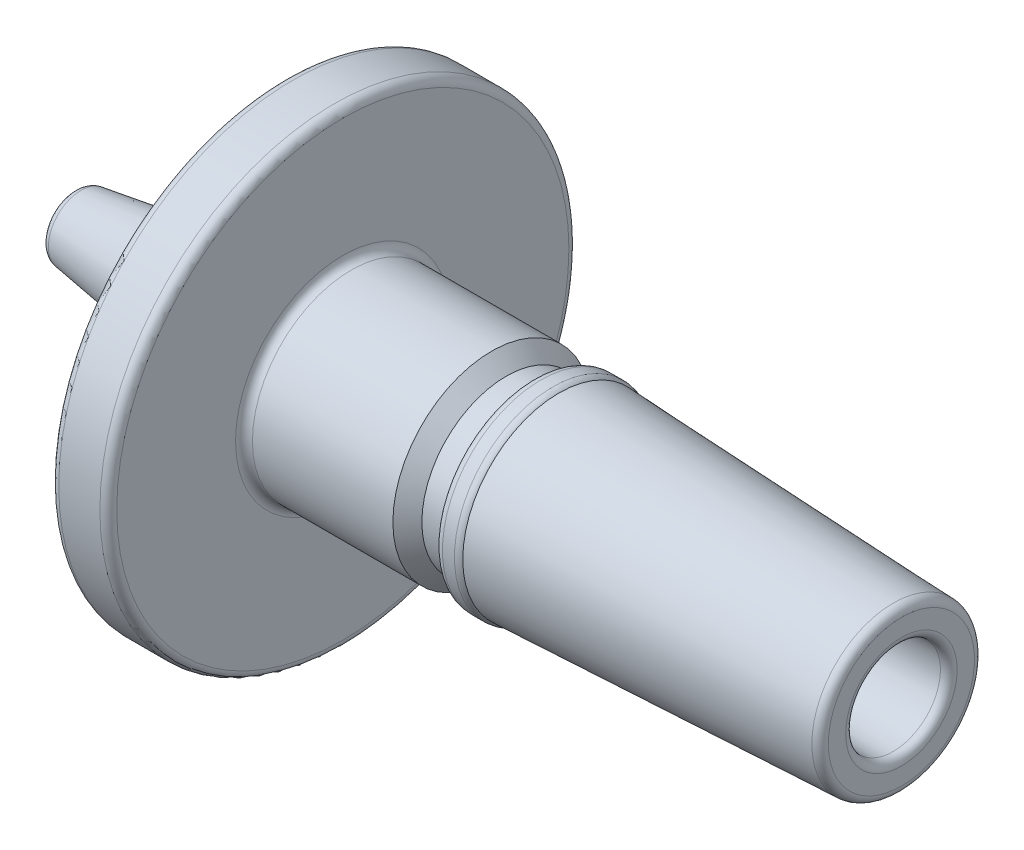
from build123d import *

# Parameters (mm, degrees)
FILLET1_R = 0.2032


with BuildPart() as part:
    # Sketch1 → Revolve1 (revolve)
    with BuildSketch(Plane(origin=(0, 0, 0), x_dir=(1, 0, 0), z_dir=(0, 1, 0)), mode=Mode.PRIVATE) as revolve1_sk:
        Polygon((1.3970000000000002, 0.9080199159363341), (14.858999999999998, 1.143), (14.858999999999998, 1.9557999999999998), (6.603999999999999, 2.3162210837097064), (6.603999999999999, 2.3749000000000002), (5.9689999999999985, 2.3749000000000002), (5.9689999999999985, 2.032), (5.333999999999999, 2.0319999999999996), (4.98475, 2.38125), (1.3970000000000005, 2.381249999999999), (1.3970000000000005, 5.6515), (0, 5.6515), (5.5e-16, 1.143), (-1.2699999999999994, 0.9525000000000002), (-2.5400000000000005, 0.9525000000000001), (-2.5400000000000005, 1.143), (-5.079999999999999, 0.762), (-5.079999999999999, 0.635), (1.397000000000001, 0.635), align=None)
    revolve(revolve1_sk.sketch.rotate(Axis((0, 0, 0), (1, 0, 0)), 180), axis=Axis((0, 0, 0), (1, 0, 0)))

    # Fillet1
    # the kernel refuses this fillet: 0.2032 mm, written as the material it adds along each edge
    with BuildSketch(Plane(origin=(-1.2699999999999994, 0, 0), x_dir=(0, 1.2e-16, 1), z_dir=(0, 1, -1.2e-16))) as fillet1_piece_1:
        with BuildLine():
            CenterArc((0.9525000000000002 + FILLET1_R, -FILLET1_R * 0.0745828053856), FILLET1_R, 171.46923439005187, 8.530765609948162)
            Line((0.9525000000000001, -FILLET1_R * 0.0745828053856), (0.9525000000000002, 0))
            Line((0.9525000000000002, 0), (0.9525000000000002 + FILLET1_R * 0.0110636471317, FILLET1_R * 0.0737576475447))
        make_face()
    revolve(axis=Axis((-1.2699999999999994, 0, 0), (1, 0, 0)))
    with BuildSketch(Plane(origin=(5.5e-16, 0, 0), x_dir=(0, 1.2e-16, 1), z_dir=(0, 1, -1.2e-16))) as fillet1_piece_2:
        with BuildLine():
            CenterArc((1.143 + FILLET1_R * 0.861187420808, -FILLET1_R), FILLET1_R, 90, 81.46923439005175)
            Line((1.143 - FILLET1_R * 0.12774893206, -FILLET1_R * 0.85165954707), (1.143, 0))
            Line((1.143, 0), (1.143 + FILLET1_R * 0.861187420808, -5.5e-16))
        make_face()
    revolve(axis=Axis((5.5e-16, 0, 0), (1, 0, 0)))
    with BuildSketch(Plane(origin=(1.3970000000000005, 0, 0), x_dir=(0, 1.2e-16, 1), z_dir=(0, 1, -1.2e-16))) as fillet1_piece_3:
        with BuildLine():
            CenterArc((2.381249999999999 + FILLET1_R, FILLET1_R), FILLET1_R, 180, 89.99999999999977)
            Line((2.381249999999999 + FILLET1_R, 0), (2.381249999999999, 0))
            Line((2.381249999999999, 0), (2.38125, FILLET1_R))
        make_face()
    revolve(axis=Axis((1.3970000000000005, 0, 0), (1, 0, 0)))
    # the kernel refuses this fillet: 0.2032 mm, written as the material it takes off along each edge
    with BuildSketch(Plane(origin=(-5.079999999999999, 0, 0), x_dir=(0, 1.2e-16, 1), z_dir=(0, 1, -1.2e-16))) as fillet1_2_piece_1:
        with BuildLine():
            CenterArc((0.5861113953629584, 0.19723119514073506), FILLET1_R, 283.92157342879153, 67.54766096126022)
            Line((0.7870632622657965, 0.16708841510530892), (0.762, 0))
            Line((0.762, 0), (0.6350000000000002, -8.9e-16))
        make_face()
    revolve(axis=Axis((-5.079999999999999, 0, 0), (1, 0, 0)), mode=Mode.SUBTRACT)
    with BuildSketch(Plane(origin=(0, 0, 0), x_dir=(0, 1.2e-16, 1), z_dir=(0, 1, -1.2e-16))) as fillet1_2_piece_2:
        with BuildLine():
            CenterArc((5.6515 - FILLET1_R, FILLET1_R), FILLET1_R, 270, 90.00000000000001)
            Line((5.6515, FILLET1_R), (5.6515, 0))
            Line((5.6515, 0), (5.6515 - FILLET1_R, 0))
        make_face()
    revolve(axis=Axis((0, 0, 0), (1, 0, 0)), mode=Mode.SUBTRACT)
    with BuildSketch(Plane(origin=(1.3970000000000005, 0, 0), x_dir=(0, 1.2e-16, 1), z_dir=(0, 1, -1.2e-16))) as fillet1_2_piece_3:
        with BuildLine():
            CenterArc((5.6515 - FILLET1_R, -FILLET1_R), FILLET1_R, 0, 90)
            Line((5.6515, -FILLET1_R), (5.6515, 0))
            Line((5.6515, 0), (5.6515 - FILLET1_R, 0))
        make_face()
    revolve(axis=Axis((1.3970000000000005, 0, 0), (1, 0, 0)), mode=Mode.SUBTRACT)
    with BuildSketch(Plane(origin=(5.9689999999999985, 0, 0), x_dir=(0, 1.2e-16, 1), z_dir=(0, 1, -1.2e-16))) as fillet1_2_piece_4:
        with BuildLine():
            CenterArc((2.3749000000000002 - FILLET1_R, FILLET1_R), FILLET1_R, 270, 90)
            Line((2.3749000000000002 - FILLET1_R, 0), (2.3749000000000002, 0))
            Line((2.3749000000000002, 0), (2.3749000000000002, FILLET1_R))
        make_face()
    revolve(axis=Axis((5.9689999999999985, 0, 0), (1, 0, 0)), mode=Mode.SUBTRACT)
    with BuildSketch(Plane(origin=(6.603999999999999, 0, 0), x_dir=(0, 1.2e-16, 1), z_dir=(0, 1, -1.2e-16))) as fillet1_2_piece_5:
        with BuildLine():
            CenterArc((2.1717000000000004, -0.14284220791969027), FILLET1_R, 0, 44.66526203773208)
            Line((2.3749000000000002, -0.14284220791969027), (2.3749000000000002, 0))
            Line((2.3749000000000002, 0), (2.316221083709707, 0))
        make_face()
    revolve(axis=Axis((6.603999999999999, 0, 0), (1, 0, 0)), mode=Mode.SUBTRACT)
    with BuildSketch(Plane(origin=(14.858999999999998, 0, 0), x_dir=(0, 1.2e-16, 1), z_dir=(0, 1, -1.2e-16))) as fillet1_2_piece_6:
        with BuildLine():
            CenterArc((1.9557999999999998 - FILLET1_R * 0.957291742255, -FILLET1_R), FILLET1_R, 2.4999999999998623, 87.50000000000011)
            Line((1.9557999999999998 + FILLET1_R * 0.041756479327, -FILLET1_R * 0.956380612635), (1.9557999999999998, 0))
            Line((1.9557999999999998, 0), (1.9557999999999998 - FILLET1_R * 0.957291742255, 0))
        make_face()
    revolve(axis=Axis((14.858999999999998, 0, 0), (1, 0, 0)), mode=Mode.SUBTRACT)
    with BuildSketch(Plane(origin=(14.858999999999998, 0, 0), x_dir=(0, 1.2e-16, 1), z_dir=(0, 1, -1.2e-16))) as fillet1_2_piece_7:
        with BuildLine():
            CenterArc((1.143 + FILLET1_R * 0.982697263116, -FILLET1_R), FILLET1_R, 90.00000000000006, 88.99999999999983)
            Line((1.143 + FILLET1_R * 0.982697263116, 1.78e-15), (1.143, 0))
            Line((1.143, 0), (1.143 - FILLET1_R * 0.0171504320407, -FILLET1_R * 0.982547593563))
        make_face()
    revolve(axis=Axis((14.858999999999998, 0, 0), (1, 0, 0)), mode=Mode.SUBTRACT)


solid = part.part
